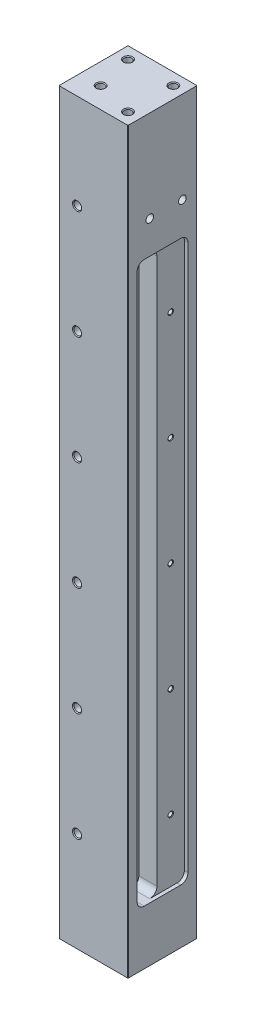
from build123d import *

# Parameters (mm, degrees)
BOSS_EXTRUDE1_DEPTH             = 490
M5X0_8_TAPPED_HOLE1_AT_2_COUNT  = 2
M5X0_8_TAPPED_HOLE1_AT_2_PITCH  = 60
M5X0_8_TAPPED_HOLE1_AT_3_COUNT  = 2
M5X0_8_TAPPED_HOLE1_AT_3_PITCH  = 120
M5X0_8_TAPPED_HOLE1_AT_4_COUNT  = 2
M5X0_8_TAPPED_HOLE1_AT_4_PITCH  = 180
M5X0_8_TAPPED_HOLE1_AT_5_COUNT  = 2
M5X0_8_TAPPED_HOLE1_AT_5_PITCH  = 240
M5X0_8_TAPPED_HOLE1_AT_6_COUNT  = 2
M5X0_8_TAPPED_HOLE1_AT_6_PITCH  = 300
M5X0_8_TAPPED_HOLE1_AT_7_COUNT  = 2
M5X0_8_TAPPED_HOLE1_AT_7_PITCH  = 360
M5X0_8_TAPPED_HOLE1_AT_8_COUNT  = 2
M5X0_8_TAPPED_HOLE1_AT_8_PITCH  = 420
M5X0_8_TAPPED_HOLE3_AT_2_COUNT  = 2
M5X0_8_TAPPED_HOLE3_AT_2_PITCH  = 18
CUT_EXTRUDE1_DEPTH              = 2
FILLET1_R                       = 4
M3X0_5_TAPPED_HOLE1_AT_2_COUNT  = 2
M3X0_5_TAPPED_HOLE1_AT_2_PITCH  = 60
M3X0_5_TAPPED_HOLE1_AT_3_COUNT  = 2
M3X0_5_TAPPED_HOLE1_AT_3_PITCH  = 120
M3X0_5_TAPPED_HOLE1_AT_4_COUNT  = 2
M3X0_5_TAPPED_HOLE1_AT_4_PITCH  = 180
M3X0_5_TAPPED_HOLE1_AT_5_COUNT  = 2
M3X0_5_TAPPED_HOLE1_AT_5_PITCH  = 240
CUT_EXTRUDE4_START              = -10
CUT_EXTRUDE4_DEPTH              = 10
FILLET1_OF_MIRROR2_R            = 4
CUT_EXTRUDE2_DEPTH              = 82.5
M6X1_0_TAPPED_HOLE1_D           = 5
M6X1_0_TAPPED_HOLE1_DEPTH       = 17
M6X1_0_TAPPED_HOLE1_CSINK_D     = 6.05
M6X1_0_TAPPED_HOLE1_CSINK_ANGLE = 90
M6X1_0_TAPPED_HOLE1_TIP         = 1.5021515475689007
CHAMFER1_SIZE                   = 0.25
M5X0_8_TAPPED_HOLE4_D           = 4.2
M5X0_8_TAPPED_HOLE4_DEPTH       = 12.4
M5X0_8_TAPPED_HOLE4_CSINK_D     = 5.05
M5X0_8_TAPPED_HOLE4_CSINK_ANGLE = 90
M5X0_8_TAPPED_HOLE4_TIP         = 1.2618072999578767
M5X0_8_TAPPED_HOLE5_D           = 4.2
M5X0_8_TAPPED_HOLE5_DEPTH       = 12.4
M5X0_8_TAPPED_HOLE5_CSINK_D     = 5.05
M5X0_8_TAPPED_HOLE5_CSINK_ANGLE = 90
M5X0_8_TAPPED_HOLE5_TIP         = 1.2618072999578767


with BuildPart() as part:
    # Sketch1 → Boss-Extrude1 (new body)
    with BuildSketch(Plane(origin=(0, 0, 0), x_dir=(1, 0, 0), z_dir=(0, 1, 0))):
        Polygon((19.05, -19.05), (-19.05, -19.050000000000008), (-19.05, 19.049999999999994), (19.05, 19.05), align=None)
    extrude(amount=BOSS_EXTRUDE1_DEPTH)

    # Sketch6 → M5x0.8 Tapped Hole1 (revolve, cut)
    with BuildSketch(Plane(origin=(-19.05, 475, 9.050000000000006), x_dir=(0, 0, 1), z_dir=(0, 1, 0))):
        Polygon((0, 0), (-2.12e-15, 8.661807299957875), (2.099999999999998, 7.4), (2.0999999999999996, 0.42500000000000177), (2.525, 0), align=None)
    m5x0_8_tapped_hole1 = revolve(axis=Axis((-25.39999999999999, 475, 9.050000000000006), (1, 0, 0)), mode=Mode.SUBTRACT)

    # M5x0.8 Tapped Hole1 at 2: M5x0.8 Tapped Hole1 ×2
    with Locations(*[(0, -i * M5X0_8_TAPPED_HOLE1_AT_2_PITCH, 0) for i in range(1, M5X0_8_TAPPED_HOLE1_AT_2_COUNT)]):
        add(m5x0_8_tapped_hole1, mode=Mode.SUBTRACT)

    # M5x0.8 Tapped Hole1 at 3: M5x0.8 Tapped Hole1 ×2
    with Locations(*[(0, -i * M5X0_8_TAPPED_HOLE1_AT_3_PITCH, 0) for i in range(1, M5X0_8_TAPPED_HOLE1_AT_3_COUNT)]):
        add(m5x0_8_tapped_hole1, mode=Mode.SUBTRACT)

    # M5x0.8 Tapped Hole1 at 4: M5x0.8 Tapped Hole1 ×2
    with Locations(*[(0, -i * M5X0_8_TAPPED_HOLE1_AT_4_PITCH, 0) for i in range(1, M5X0_8_TAPPED_HOLE1_AT_4_COUNT)]):
        add(m5x0_8_tapped_hole1, mode=Mode.SUBTRACT)

    # M5x0.8 Tapped Hole1 at 5: M5x0.8 Tapped Hole1 ×2
    with Locations(*[(0, -i * M5X0_8_TAPPED_HOLE1_AT_5_PITCH, 0) for i in range(1, M5X0_8_TAPPED_HOLE1_AT_5_COUNT)]):
        add(m5x0_8_tapped_hole1, mode=Mode.SUBTRACT)

    # M5x0.8 Tapped Hole1 at 6: M5x0.8 Tapped Hole1 ×2
    with Locations(*[(0, -i * M5X0_8_TAPPED_HOLE1_AT_6_PITCH, 0) for i in range(1, M5X0_8_TAPPED_HOLE1_AT_6_COUNT)]):
        add(m5x0_8_tapped_hole1, mode=Mode.SUBTRACT)

    # M5x0.8 Tapped Hole1 at 7: M5x0.8 Tapped Hole1 ×2
    with Locations(*[(0, -i * M5X0_8_TAPPED_HOLE1_AT_7_PITCH, 0) for i in range(1, M5X0_8_TAPPED_HOLE1_AT_7_COUNT)]):
        add(m5x0_8_tapped_hole1, mode=Mode.SUBTRACT)

    # M5x0.8 Tapped Hole1 at 8: M5x0.8 Tapped Hole1 ×2
    with Locations(*[(0, -i * M5X0_8_TAPPED_HOLE1_AT_8_PITCH, 0) for i in range(1, M5X0_8_TAPPED_HOLE1_AT_8_COUNT)]):
        add(m5x0_8_tapped_hole1, mode=Mode.SUBTRACT)

    # Sketch10 → M5x0.8 Tapped Hole3 (revolve, cut)
    with BuildSketch(Plane(origin=(19.05, 357, 7.049999999999999), x_dir=(0, 0, -1), z_dir=(0, 1, 0))):
        Polygon((0, 0), (-1.88e-15, 7.661807299957876), (2.099999999999999, 6.3999999999999995), (2.099999999999989, -1.3e-15), align=None)
    m5x0_8_tapped_hole3 = revolve(axis=Axis((25.39999999999999, 357, 7.049999999999999), (-1, 0, 0)), mode=Mode.SUBTRACT)

    # M5x0.8 Tapped Hole3 at 2: M5x0.8 Tapped Hole3 ×2
    with Locations(*[(0, 0, -i * M5X0_8_TAPPED_HOLE3_AT_2_PITCH) for i in range(1, M5X0_8_TAPPED_HOLE3_AT_2_COUNT)]):
        add(m5x0_8_tapped_hole3, mode=Mode.SUBTRACT)

    # Sketch11 → Cut-Extrude1 (cut)
    with BuildSketch(Plane(origin=(19.05, 0, 0), x_dir=(0, 0, -1), z_dir=(1, 0, 0))):
        Polygon((14.05, 338.99999999999994), (-14.05, 339), (-14.049999999999962, 30), (14.050000000000038, 30), align=None)
    cut_extrude1 = extrude(amount=-CUT_EXTRUDE1_DEPTH, mode=Mode.SUBTRACT)

    # Fillet1
    fillet1_edges = [part.edges().sort_by_distance(p)[0] for p in [
        (18.05, 30, 14.049999999999962),
        (18.05, 30, -14.050000000000038),
        (18.05, 338.99999999999994, -14.05),
        (18.05, 339, 14.05),
    ]]
    fillet(fillet1_edges, radius=FILLET1_R)

    # Sketch13 → M3x0.5 Tapped Hole1 (revolve, cut)
    with BuildSketch(Plane(origin=(17.050000000000004, 64.5, -6.550000000000001), x_dir=(0, 0, -1), z_dir=(0, 1, 0))):
        Polygon((0, 0), (-2.02e-15, 8.25107577378445), (1.249999999999998, 7.5), (1.2499999999999991, 0.2750000000000009), (1.525, 0), align=None)
    m3x0_5_tapped_hole1 = revolve(axis=Axis((23.399999999999995, 64.5, -6.550000000000001), (-1, 0, 0)), mode=Mode.SUBTRACT)

    # M3x0.5 Tapped Hole1 at 2: M3x0.5 Tapped Hole1 ×2
    with Locations(*[(0, i * M3X0_5_TAPPED_HOLE1_AT_2_PITCH, 0) for i in range(1, M3X0_5_TAPPED_HOLE1_AT_2_COUNT)]):
        add(m3x0_5_tapped_hole1, mode=Mode.SUBTRACT)

    # M3x0.5 Tapped Hole1 at 3: M3x0.5 Tapped Hole1 ×2
    with Locations(*[(0, i * M3X0_5_TAPPED_HOLE1_AT_3_PITCH, 0) for i in range(1, M3X0_5_TAPPED_HOLE1_AT_3_COUNT)]):
        add(m3x0_5_tapped_hole1, mode=Mode.SUBTRACT)

    # M3x0.5 Tapped Hole1 at 4: M3x0.5 Tapped Hole1 ×2
    with Locations(*[(0, i * M3X0_5_TAPPED_HOLE1_AT_4_PITCH, 0) for i in range(1, M3X0_5_TAPPED_HOLE1_AT_4_COUNT)]):
        add(m3x0_5_tapped_hole1, mode=Mode.SUBTRACT)

    # M3x0.5 Tapped Hole1 at 5: M3x0.5 Tapped Hole1 ×2
    with Locations(*[(0, i * M3X0_5_TAPPED_HOLE1_AT_5_PITCH, 0) for i in range(1, M3X0_5_TAPPED_HOLE1_AT_5_COUNT)]):
        add(m3x0_5_tapped_hole1, mode=Mode.SUBTRACT)

    # Sketch25 → Cut-Extrude4 (cut)
    with BuildSketch(Plane(origin=(17.050000000000004, 0, 0), x_dir=(0, 0, -1), z_dir=(1, 0, 0)).offset(CUT_EXTRUDE4_START)):
        with BuildLine():
            Line((-14.05, 335), (-14.049999999999962, 33.99999999999997))
            ThreePointArc((-14.049999999999962, 33.99999999999997), (-12.87842712474614, 31.1715728752538), (-10.049999999999962, 30))
            Line((-10.049999999999962, 30), (-5.049999999999964, 30))
            ThreePointArc((-5.049999999999964, 30), (-2.221572875253785, 31.1715728752538), (-1.0499999999999658, 33.99999999999997))
            Line((-1.0499999999999658, 33.99999999999997), (-1.0499999999999972, 335))
            ThreePointArc((-1.0499999999999972, 335), (-2.2215728752538118, 337.8284271247462), (-5.05000000000001, 339))
            Line((-5.05000000000001, 339), (-10.04999999999999, 339))
            ThreePointArc((-10.04999999999999, 339), (-12.878427124746187, 337.8284271247462), (-14.05, 335))
        make_face()
    cut_extrude4 = extrude(amount=CUT_EXTRUDE4_DEPTH, mode=Mode.SUBTRACT)

    # Mirror2: M5x0.8 Tapped Hole1, M5x0.8 Tapped Hole3, Cut-Extrude1, M3x0.5 Tapped Hole1, Cut-Extrude4 across plane
    add(m5x0_8_tapped_hole1.mirror(Plane(origin=(0, 0, 0), x_dir=(-0.7071067811865475, 0, 0.7071067811865477), z_dir=(-0.7071067811865476, 0, -0.7071067811865475))), mode=Mode.SUBTRACT)
    add(m5x0_8_tapped_hole3.mirror(Plane(origin=(0, 0, 0), x_dir=(-0.7071067811865475, 0, 0.7071067811865477), z_dir=(-0.7071067811865476, 0, -0.7071067811865475))), mode=Mode.SUBTRACT)
    add(cut_extrude1.mirror(Plane(origin=(0, 0, 0), x_dir=(-0.7071067811865475, 0, 0.7071067811865477), z_dir=(-0.7071067811865476, 0, -0.7071067811865475))), mode=Mode.SUBTRACT)
    add(m3x0_5_tapped_hole1.mirror(Plane(origin=(0, 0, 0), x_dir=(-0.7071067811865475, 0, 0.7071067811865477), z_dir=(-0.7071067811865476, 0, -0.7071067811865475))), mode=Mode.SUBTRACT)
    add(cut_extrude4.mirror(Plane(origin=(0, 0, 0), x_dir=(-0.7071067811865475, 0, 0.7071067811865477), z_dir=(-0.7071067811865476, 0, -0.7071067811865475))), mode=Mode.SUBTRACT)

    # Mirror2 copy 1 sketch → Mirror2 copy 1 (revolve, cut)
    with BuildSketch(Plane(origin=(-9.050000000000002, 415, 19.050000000000004), x_dir=(-1, 0, 2.2e-16), z_dir=(0, 1, 0))):
        Polygon((0, 0), (-2.12e-15, -8.661807299957875), (2.099999999999998, -7.4), (2.0999999999999996, -0.42500000000000177), (2.525, 0), align=None)
    revolve(axis=Axis((-9.05, 415, 25.399999999999995), (2.2e-16, 0, 1)), mode=Mode.SUBTRACT)

    # Mirror2 copy 2 sketch → Mirror2 copy 2 (revolve, cut)
    with BuildSketch(Plane(origin=(-9.050000000000002, 355, 19.050000000000004), x_dir=(-1, 0, 2.2e-16), z_dir=(0, 1, 0))):
        Polygon((0, 0), (-2.12e-15, -8.661807299957875), (2.099999999999998, -7.4), (2.0999999999999996, -0.42500000000000177), (2.525, 0), align=None)
    revolve(axis=Axis((-9.05, 355, 25.399999999999995), (2.2e-16, 0, 1)), mode=Mode.SUBTRACT)

    # Mirror2 copy 3 sketch → Mirror2 copy 3 (revolve, cut)
    with BuildSketch(Plane(origin=(-9.050000000000002, 295, 19.050000000000004), x_dir=(-1, 0, 2.2e-16), z_dir=(0, 1, 0))):
        Polygon((0, 0), (-2.12e-15, -8.661807299957875), (2.099999999999998, -7.4), (2.0999999999999996, -0.42500000000000177), (2.525, 0), align=None)
    revolve(axis=Axis((-9.05, 295, 25.399999999999995), (2.2e-16, 0, 1)), mode=Mode.SUBTRACT)

    # Mirror2 copy 4 sketch → Mirror2 copy 4 (revolve, cut)
    with BuildSketch(Plane(origin=(-9.050000000000002, 235, 19.050000000000004), x_dir=(-1, 0, 2.2e-16), z_dir=(0, 1, 0))):
        Polygon((0, 0), (-2.12e-15, -8.661807299957875), (2.099999999999998, -7.4), (2.0999999999999996, -0.42500000000000177), (2.525, 0), align=None)
    revolve(axis=Axis((-9.05, 235, 25.399999999999995), (2.2e-16, 0, 1)), mode=Mode.SUBTRACT)

    # Mirror2 copy 5 sketch → Mirror2 copy 5 (revolve, cut)
    with BuildSketch(Plane(origin=(-9.050000000000002, 175, 19.050000000000004), x_dir=(-1, 0, 2.2e-16), z_dir=(0, 1, 0))):
        Polygon((0, 0), (-2.12e-15, -8.661807299957875), (2.099999999999998, -7.4), (2.0999999999999996, -0.42500000000000177), (2.525, 0), align=None)
    revolve(axis=Axis((-9.05, 175, 25.399999999999995), (2.2e-16, 0, 1)), mode=Mode.SUBTRACT)

    # Mirror2 copy 6 sketch → Mirror2 copy 6 (revolve, cut)
    with BuildSketch(Plane(origin=(-9.050000000000002, 115, 19.050000000000004), x_dir=(-1, 0, 2.2e-16), z_dir=(0, 1, 0))):
        Polygon((0, 0), (-2.12e-15, -8.661807299957875), (2.099999999999998, -7.4), (2.0999999999999996, -0.42500000000000177), (2.525, 0), align=None)
    revolve(axis=Axis((-9.05, 115, 25.399999999999995), (2.2e-16, 0, 1)), mode=Mode.SUBTRACT)

    # Mirror2 copy 7 sketch → Mirror2 copy 7 (revolve, cut)
    with BuildSketch(Plane(origin=(-9.050000000000002, 55, 19.050000000000004), x_dir=(-1, 0, 2.2e-16), z_dir=(0, 1, 0))):
        Polygon((0, 0), (-2.12e-15, -8.661807299957875), (2.099999999999998, -7.4), (2.0999999999999996, -0.42500000000000177), (2.525, 0), align=None)
    revolve(axis=Axis((-9.05, 55, 25.399999999999995), (2.2e-16, 0, 1)), mode=Mode.SUBTRACT)

    # Mirror2 copy 8 sketch → Mirror2 copy 8 (revolve, cut)
    with BuildSketch(Plane(origin=(10.949999999999996, 357, -19.050000000000004), x_dir=(1, 0, -2.2e-16), z_dir=(0, 1, 0))):
        Polygon((0, 0), (-1.88e-15, -7.661807299957876), (2.099999999999999, -6.3999999999999995), (2.099999999999989, 1.3e-15), align=None)
    revolve(axis=Axis((10.949999999999996, 357, -25.399999999999995), (-2.2e-16, 0, -1)), mode=Mode.SUBTRACT)

    # Mirror2 copy 9 sketch → Mirror2 copy 9 (revolve, cut)
    with BuildSketch(Plane(origin=(6.549999999999989, 124.5, -17.050000000000004), x_dir=(1, 0, -2.2e-16), z_dir=(0, 1, 0))):
        Polygon((0, 0), (-2.02e-15, -8.25107577378445), (1.249999999999998, -7.5), (1.2499999999999991, -0.2750000000000009), (1.525, 0), align=None)
    revolve(axis=Axis((6.549999999999987, 124.5, -23.399999999999995), (-2.2e-16, 0, -1)), mode=Mode.SUBTRACT)

    # Mirror2 copy 10 sketch → Mirror2 copy 10 (revolve, cut)
    with BuildSketch(Plane(origin=(6.549999999999981, 184.5, -17.050000000000004), x_dir=(1, 0, -2.2e-16), z_dir=(0, 1, 0))):
        Polygon((0, 0), (-2.02e-15, -8.25107577378445), (1.249999999999998, -7.5), (1.2499999999999991, -0.2750000000000009), (1.525, 0), align=None)
    revolve(axis=Axis((6.549999999999979, 184.5, -23.399999999999995), (-2.2e-16, 0, -1)), mode=Mode.SUBTRACT)

    # Mirror2 copy 11 sketch → Mirror2 copy 11 (revolve, cut)
    with BuildSketch(Plane(origin=(6.549999999999974, 244.5, -17.050000000000004), x_dir=(1, 0, -2.2e-16), z_dir=(0, 1, 0))):
        Polygon((0, 0), (-2.02e-15, -8.25107577378445), (1.249999999999998, -7.5), (1.2499999999999991, -0.2750000000000009), (1.525, 0), align=None)
    revolve(axis=Axis((6.549999999999972, 244.5, -23.399999999999995), (-2.2e-16, 0, -1)), mode=Mode.SUBTRACT)

    # Mirror2 copy 12 sketch → Mirror2 copy 12 (revolve, cut)
    with BuildSketch(Plane(origin=(6.549999999999966, 304.5, -17.050000000000004), x_dir=(1, 0, -2.2e-16), z_dir=(0, 1, 0))):
        Polygon((0, 0), (-2.02e-15, -8.25107577378445), (1.249999999999998, -7.5), (1.2499999999999991, -0.2750000000000009), (1.525, 0), align=None)
    revolve(axis=Axis((6.549999999999964, 304.5, -23.399999999999995), (-2.2e-16, 0, -1)), mode=Mode.SUBTRACT)

    # Fillet1 of Mirror2
    fillet1_of_mirror2_edges = [part.edges().sort_by_distance(p)[0] for p in [
        (-14.049999999999965, 30, -18.049999999999997),
        (14.050000000000034, 30, -18.050000000000004),
        (14.049999999999997, 338.99999999999994, -18.050000000000004),
        (-14.050000000000004, 339, -18.049999999999997),
    ]]
    fillet(fillet1_of_mirror2_edges, radius=FILLET1_OF_MIRROR2_R)

    # Sketch14 → Cut-Extrude2 (cut)
    with BuildSketch(Plane(origin=(0, 490, 0), x_dir=(1, 0, 0), z_dir=(0, 1, 0))):
        Polygon((-19.05, 19.049999999999994), (-19.05, -19.050000000000008), (19.05, -19.05), (19.05, 19.05), align=None)
    extrude(amount=-CUT_EXTRUDE2_DEPTH, mode=Mode.SUBTRACT)

    # M6x1.0 Tapped Hole1
    with Locations(Plane(origin=(0, 0, 0), x_dir=(-1, 0, 0), z_dir=(0, -1, 0))):
        with Locations((7.55, -7.55)):
            CounterSinkHole(M6X1_0_TAPPED_HOLE1_D / 2, M6X1_0_TAPPED_HOLE1_CSINK_D / 2, depth=M6X1_0_TAPPED_HOLE1_DEPTH, counter_sink_angle=M6X1_0_TAPPED_HOLE1_CSINK_ANGLE)
            with Locations((0, 0, -(M6X1_0_TAPPED_HOLE1_DEPTH + M6X1_0_TAPPED_HOLE1_TIP / 2))):  # 118° drill point
                Cone(0, M6X1_0_TAPPED_HOLE1_D / 2, M6X1_0_TAPPED_HOLE1_TIP, mode=Mode.SUBTRACT)

    # Chamfer1
    chamfer1_edges = [part.edges().sort_by_distance(p)[0] for p in [
        (19.05, 203.75, 19.05),
        (-19.05, 203.75, 19.050000000000008),
        (-19.05, 203.75, -19.049999999999994),
        (19.05, 203.75, -19.05),
    ]]
    chamfer(chamfer1_edges, length=CHAMFER1_SIZE)

    # M5x0.8 Tapped Hole4
    with Locations(Plane(origin=(0, 0, 0), x_dir=(-1, 0, 0), z_dir=(0, -1, 0))):
        with Locations((-12.5, -12.5), (-12.5, 12.5), (12.5, 12.5)):
            CounterSinkHole(M5X0_8_TAPPED_HOLE4_D / 2, M5X0_8_TAPPED_HOLE4_CSINK_D / 2, depth=M5X0_8_TAPPED_HOLE4_DEPTH, counter_sink_angle=M5X0_8_TAPPED_HOLE4_CSINK_ANGLE)
            with Locations((0, 0, -(M5X0_8_TAPPED_HOLE4_DEPTH + M5X0_8_TAPPED_HOLE4_TIP / 2))):  # 118° drill point
                Cone(0, M5X0_8_TAPPED_HOLE4_D / 2, M5X0_8_TAPPED_HOLE4_TIP, mode=Mode.SUBTRACT)

    # M5x0.8 Tapped Hole5
    with Locations(Plane(origin=(0, 407.5, 0), x_dir=(1, 0, 0), z_dir=(0, 1, 0))):
        with Locations((12.5, 12.5), (-12.5, 12.5), (12.5, -12.5), (-7.55, -7.55)):
            CounterSinkHole(M5X0_8_TAPPED_HOLE5_D / 2, M5X0_8_TAPPED_HOLE5_CSINK_D / 2, depth=M5X0_8_TAPPED_HOLE5_DEPTH, counter_sink_angle=M5X0_8_TAPPED_HOLE5_CSINK_ANGLE)
            with Locations((0, 0, -(M5X0_8_TAPPED_HOLE5_DEPTH + M5X0_8_TAPPED_HOLE5_TIP / 2))):  # 118° drill point
                Cone(0, M5X0_8_TAPPED_HOLE5_D / 2, M5X0_8_TAPPED_HOLE5_TIP, mode=Mode.SUBTRACT)


solid = part.part
